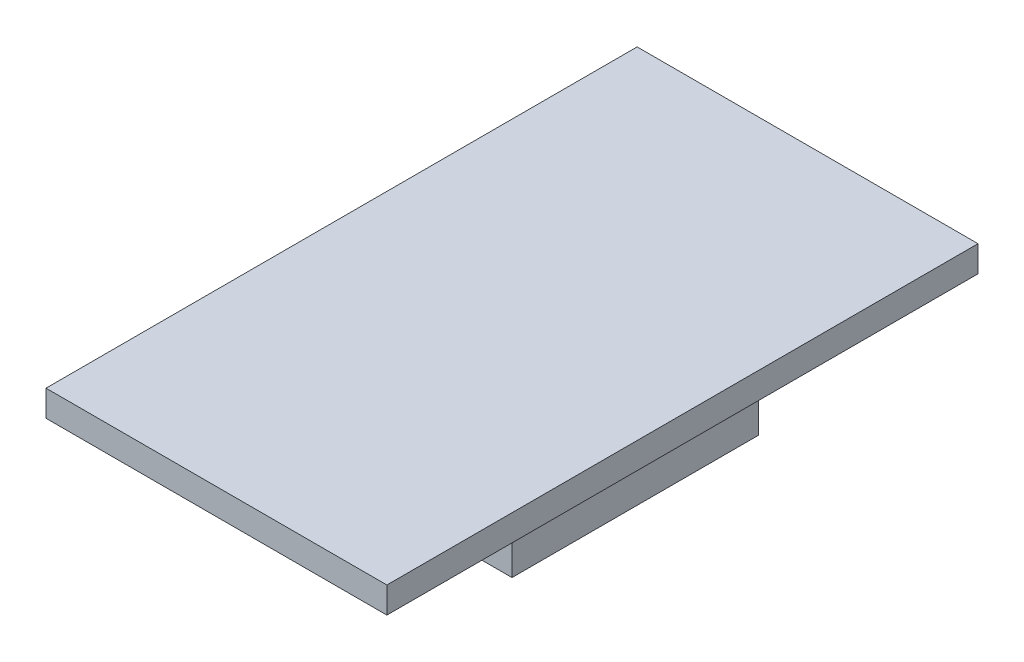
from build123d import *

# Parameters (mm, degrees)
SKETCH1_W           = 6.92
SKETCH1_H           = 12
BOSS_EXTRUDE1_DEPTH = 0.53
SKETCH2_W           = 5
SKETCH2_H           = 5
BOSS_EXTRUDE2_DEPTH = 1.57
SKETCH3_R           = 2
CUT_EXTRUDE1_DEPTH  = 0.2
CHAMFER1_SIZE       = 0.1
SKETCH6_W           = 2
SKETCH6_H           = 1.2
BOSS_EXTRUDE3_DEPTH = 0.45
CUT_EXTRUDE2_DEPTH  = 0.1


with BuildPart() as part:
    # Sketch1 → Boss-Extrude1 (new body)
    with BuildSketch(Plane(origin=(0, 0, 0), x_dir=(1, 0, 0), z_dir=(0, 1, 0))):
        Rectangle(SKETCH1_W, SKETCH1_H)
    extrude(amount=BOSS_EXTRUDE1_DEPTH)

    # Sketch2 → Boss-Extrude2 (add)
    with BuildSketch(Plane.XZ):
        Rectangle(SKETCH2_W, SKETCH2_H)
    extrude(amount=BOSS_EXTRUDE2_DEPTH)

    # Sketch3 → Cut-Extrude1 (cut)
    with BuildSketch(Plane.XZ.offset(1.57)):
        Circle(SKETCH3_R)
    extrude(amount=-CUT_EXTRUDE1_DEPTH, mode=Mode.SUBTRACT)

    # Chamfer1
    chamfer1_edges = [part.edges().sort_by_distance(p)[0] for p in [
        (-2, -1.57, 0),
    ]]
    chamfer(chamfer1_edges, length=CHAMFER1_SIZE)

    # Sketch6 → Boss-Extrude3 (add)
    with BuildSketch(Plane.XZ):
        with Locations((0, -4.25)):
            Rectangle(SKETCH6_W, SKETCH6_H)
    extrude(amount=BOSS_EXTRUDE3_DEPTH)

    # Sketch4 → Cut-Extrude2 (cut)
    with BuildSketch(Plane.XZ):
        with BuildLine():
            Line((-2.351035145, -3.451541621), (-3.46, -3.451541621))
            Line((-3.46, -3.451541621), (-3.46, -5.151541621))
            Line((-3.46, -5.151541621), (-2.351035145, -5.151541621))
            ThreePointArc((-2.351035145, -5.151541621), (-1.501035145, -4.301541621), (-2.351035145, -3.451541621))
        make_face()
        with BuildLine():
            Line((-3.46, 3.451541621), (-3.46, 5.151541621))
            Line((-3.46, 5.151541621), (-2.351035145, 5.151541621))
            ThreePointArc((-2.351035145, 5.151541621), (-1.501035145, 4.301541621), (-2.351035145, 3.451541621))
            Line((-2.351035145, 3.451541621), (-3.46, 3.451541621))
        make_face()
        with BuildLine():
            Line((-3.46, 0.85), (-3.46, -0.85))
            ThreePointArc((-3.46, -0.85), (-2.61, 0), (-3.46, 0.85))
        make_face()
    extrude(amount=-CUT_EXTRUDE2_DEPTH, mode=Mode.SUBTRACT)


solid = part.part
